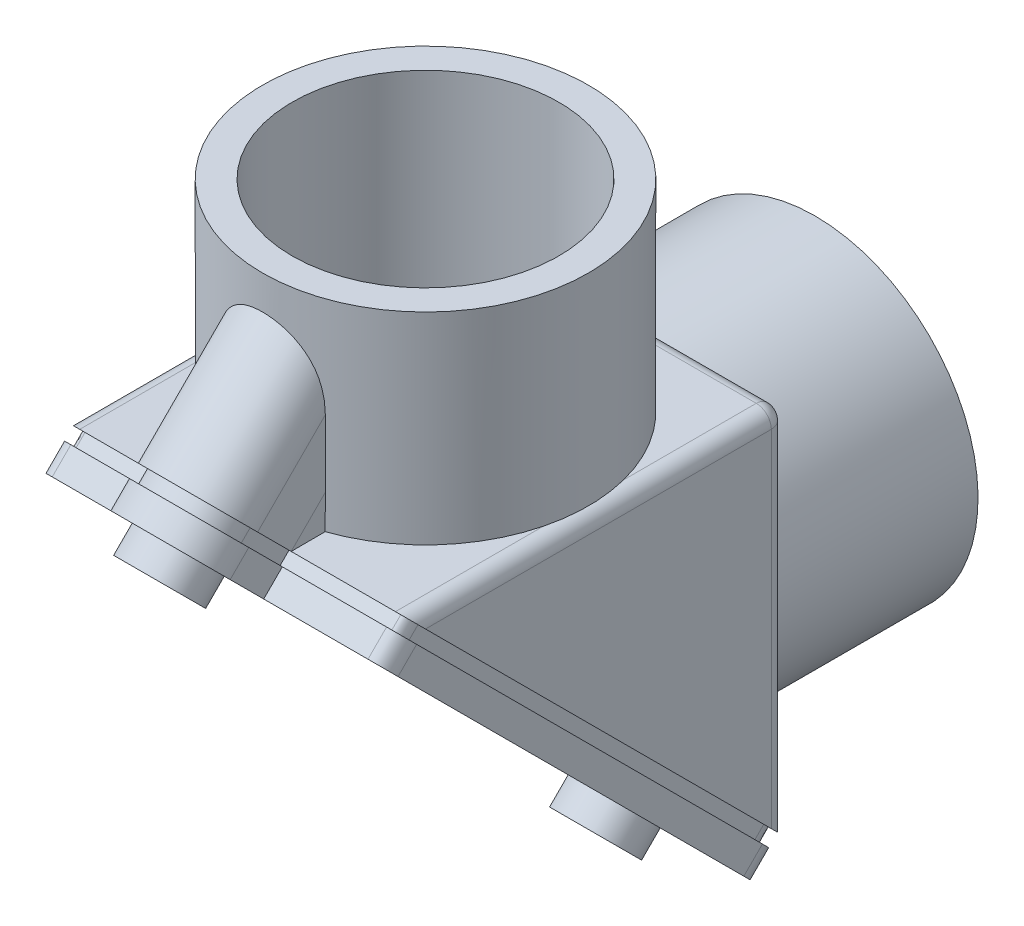
from build123d import *

# Parameters (mm, degrees)
EXTRUDE1_DEPTH                = 17.526
EXTRUDE1_DEPTH_BACK           = 17.526
FILLET1_R                     = 1.524
SHELL1_T                      = -3.81
COVERMTNGHUBS_EXTRUDE2_DEPTH  = 17.526
ODSOCKETBOSS_SKETCH2_R        = 16.51
EXTRUDE3_DEPTH                = 20.447
ODSOCKETBOSS_SKETCH4_R        = 16.51
EXTRUDE4_DEPTH                = 20.447
SKETCH6_R                     = 13.5128
SOCKET_CUT_EXTRUDE1_DEPTH     = 19.8374
SKETCH7_R                     = 13.5128
SOCKET_CUT_EXTRUDE2_DEPTH     = 19.8374
SKETCH8_R                     = 10.795
SOCKETTHRU_CUT_EXTRUDE3_DEPTH = 64.078716778
SKETCH9_R                     = 10.795
SOCKETTHRU_CUT_EXTRUDE4_DEPTH = 64.078716778
EXTRUDE5_DEPTH                = 1.27
EXTRUDE6_START                = 2.667
EXTRUDE6_DEPTH                = 2.667
SKETCH12_R                    = 3.81
EXTRUDE7_DEPTH                = 2.667


with BuildPart() as part:
    # Sketch1 → Extrude1 (new, two sides: drawn at the far end of the back side and taken through both)
    with BuildSketch(Plane(origin=(0, 0, 0), x_dir=(0, 0, -1), z_dir=(1, 0, 0)).offset(-EXTRUDE1_DEPTH_BACK)):
        Polygon((0, 19.05), (-19.05, 19.05), (19.05, -19.05), (19.05, 0), (19.05, 19.05), align=None)
    extrude(amount=EXTRUDE1_DEPTH + EXTRUDE1_DEPTH_BACK)

    # Fillet1
    fillet1_edges = [part.edges().sort_by_distance(p)[0] for p in [
        (-17.526, 0, -19.05),
        (-17.526, 19.05, 0),
        (0, 19.05, -19.05),
        (17.526, 0, -19.05),
        (17.526, 19.05, 0),
    ]]
    fillet(fillet1_edges, radius=FILLET1_R)

    # Shell1
    shell1_openings = [part.faces().sort_by_distance(p)[0] for p in [
        (0, 0, 0),
    ]]
    offset(amount=SHELL1_T, openings=shell1_openings, kind=Kind.INTERSECTION)

    # Sketch5 → CoverMtngHubs-Extrude2 (add)
    with BuildSketch(Plane(origin=(0, 0, 0), x_dir=(1, 0, 0), z_dir=(0, -0.7071067811865477, 0.7071067811865475))):
        with BuildLine():
            Line((-5.4356, 31.75), (-5.4356, 26.940768363))
            Line((-5.4356, 26.940768363), (-5.4356, 22.712927931))
            Line((-5.4356, 22.712927931), (5.41587582, 22.712927931))
            Line((5.41587582, 22.712927931), (5.4356, 26.940768363))
            Line((5.4356, 26.940768363), (5.4356, 31.75))
            ThreePointArc((5.4356, 31.75), (0, 37.1856), (-5.4356, 31.75))
        make_face()
        with BuildLine():
            Line((5.4356, -31.75), (5.4356, -26.940768363))
            Line((5.4356, -26.940768363), (5.41587582, -22.712927931))
            Line((5.41587582, -22.712927931), (-5.4356, -22.712927931))
            Line((-5.4356, -22.712927931), (-5.4356, -26.940768363))
            Line((-5.4356, -26.940768363), (-5.4356, -31.75))
            ThreePointArc((-5.4356, -31.75), (0, -37.1856), (5.4356, -31.75))
        make_face()
    extrude(amount=-COVERMTNGHUBS_EXTRUDE2_DEPTH)

    # ODsocketboss-Sketch2 → Extrude3 (add)
    with BuildSketch(Plane(origin=(0, 19.05, 0), x_dir=(-1, 0, 0), z_dir=(0, 1, 0))):
        Circle(ODSOCKETBOSS_SKETCH2_R)
    extrude(amount=EXTRUDE3_DEPTH)

    # ODsocketboss-Sketch4 → Extrude4 (add)
    with BuildSketch(Plane(origin=(0, 0, -19.05), x_dir=(-1, 0, 0), z_dir=(0, 0, -1))):
        Circle(ODSOCKETBOSS_SKETCH4_R)
    extrude(amount=EXTRUDE4_DEPTH)

    # Sketch6 → Socket--Cut-Extrude1 (cut)
    with BuildSketch(Plane(origin=(0, 0, -39.497), x_dir=(-1, 0, 0), z_dir=(0, 0, -1))):
        Circle(SKETCH6_R)
    extrude(amount=-SOCKET_CUT_EXTRUDE1_DEPTH, mode=Mode.SUBTRACT)

    # Sketch7 → Socket--Cut-Extrude2 (cut)
    with BuildSketch(Plane(origin=(0, 39.497, 0), x_dir=(-1, 0, 0), z_dir=(0, 1, 0))):
        Circle(SKETCH7_R)
    extrude(amount=-SOCKET_CUT_EXTRUDE2_DEPTH, mode=Mode.SUBTRACT)

    # Sketch8 → SocketTHRU-Cut-Extrude3 (cut, through all)
    with BuildSketch(Plane(origin=(0, 0, -19.6596), x_dir=(-1, 0, 0), z_dir=(0, 0, -1))):
        Circle(SKETCH8_R)
    extrude(amount=-SOCKETTHRU_CUT_EXTRUDE3_DEPTH, mode=Mode.SUBTRACT)

    # Sketch9 → SocketTHRU-Cut-Extrude4 (cut, through all)
    with BuildSketch(Plane(origin=(0, 19.6596, 0), x_dir=(-1, 0, 0), z_dir=(0, 1, 0))):
        Circle(SKETCH9_R)
    extrude(amount=-SOCKETTHRU_CUT_EXTRUDE4_DEPTH, mode=Mode.SUBTRACT)

    # Sketch10 → Extrude5 (add)
    with BuildSketch(Plane(origin=(0, 0, 0), x_dir=(1, 0, 0), z_dir=(0, -0.7071067811865477, 0.7071067811865475))):
        with BuildLine():
            Line((-4.6736, 31.75), (-4.6736, 26.178768363))
            Line((-4.6736, 26.178768363), (-16.002, 26.178768363))
            add(Edge.make_bspline(
                [(-16.002, 26.178768363), (-16.074874104, 26.178768363), (-16.144329506, 26.152769922), (-16.267023759, 26.078983528), (-16.321851808, 26.030722145), (-16.466647042, 25.873249143), (-16.540927648, 25.747914689), (-16.65540061, 25.488073251), (-16.696734257, 25.349541873), (-16.750804354, 25.07034225), (-16.764, 24.928834274), (-16.764, 24.785506894)],
                knots=[0, 0, 0, 0, 0.125, 0.125, 0.25, 0.25, 0.5, 0.5, 0.75, 0.75, 1, 1, 1, 1], degree=3))
            Line((-16.764, 24.785506894), (-16.764, -24.785506894))
            add(Edge.make_bspline(
                [(-16.764, -24.785506894), (-16.764, -24.928904831), (-16.750787013, -25.070024584), (-16.697192472, -25.347579683), (-16.656344373, -25.485586581), (-16.541283192, -25.747448207), (-16.467043517, -25.872703505), (-16.322186584, -26.030414967), (-16.26747506, -26.07865822), (-16.144508265, -26.152716047), (-16.074734527, -26.178768363), (-16.002, -26.178768363)],
                knots=[0, 0, 0, 0, 0.25, 0.25, 0.5, 0.5, 0.75, 0.75, 0.875, 0.875, 1, 1, 1, 1], degree=3))
            Line((-16.002, -26.178768363), (-4.6736, -26.178768363))
            Line((-4.6736, -26.178768363), (-4.6736, -31.75))
            ThreePointArc((-4.6736, -31.75), (0, -36.4236), (4.6736, -31.75))
            Line((4.6736, -31.75), (4.6736, -26.178768363))
            Line((4.6736, -26.178768363), (16.002, -26.178768363))
            add(Edge.make_bspline(
                [(16.002, -26.178768363), (16.074874104, -26.178768363), (16.144329506, -26.152769922), (16.267023759, -26.078983528), (16.321851808, -26.030722145), (16.466647042, -25.873249143), (16.540927648, -25.747914689), (16.65540061, -25.488073251), (16.696734257, -25.349541873), (16.750804354, -25.07034225), (16.764, -24.928834274), (16.764, -24.785506894)],
                knots=[0, 0, 0, 0, 0.125, 0.125, 0.25, 0.25, 0.5, 0.5, 0.75, 0.75, 1, 1, 1, 1], degree=3))
            Line((16.764, -24.785506894), (16.764, 24.785506894))
            add(Edge.make_bspline(
                [(16.764, 24.785506894), (16.764, 24.928904831), (16.750787013, 25.070024584), (16.697192472, 25.347579683), (16.656344373, 25.485586581), (16.541283192, 25.747448207), (16.467043517, 25.872703505), (16.322186584, 26.030414967), (16.26747506, 26.07865822), (16.144508265, 26.152716047), (16.074734527, 26.178768363), (16.002, 26.178768363)],
                knots=[0, 0, 0, 0, 0.25, 0.25, 0.5, 0.5, 0.75, 0.75, 0.875, 0.875, 1, 1, 1, 1], degree=3))
            Line((16.002, 26.178768363), (4.6736, 26.178768363))
            Line((4.6736, 26.178768363), (4.6736, 31.75))
            ThreePointArc((4.6736, 31.75), (0, 36.4236), (-4.6736, 31.75))
        make_face()
    extrude(amount=EXTRUDE5_DEPTH)

    # Sketch11 → Extrude6 (add)
    with BuildSketch(Plane(origin=(0, -0.898025612, 0.898025612), x_dir=(1, 0, 0), z_dir=(0, -0.7071067811865476, 0.7071067811865476)).offset(EXTRUDE6_START)):
        with BuildLine():
            Line((-5.4356, 31.75), (-5.4356, 26.940768363))
            Line((-5.4356, 26.940768363), (-16.002, 26.940768363))
            add(Edge.make_bspline(
                [(-16.002, 26.940768363), (-17.526, 26.940768363), (-17.526, 24.785506894)],
                knots=[3.141592654, 3.141592654, 3.141592654, 4.71238898, 4.71238898, 4.71238898], degree=2, weights=[1, 0.707106781, 1]))
            Line((-17.526, 24.785506894), (-17.526, -24.785506894))
            add(Edge.make_bspline(
                [(-17.526, -24.785506894), (-17.526, -26.940768363), (-16.002, -26.940768363)],
                knots=[4.71238898, 4.71238898, 4.71238898, 6.283185307, 6.283185307, 6.283185307], degree=2, weights=[1, 0.707106781, 1]))
            Line((-16.002, -26.940768363), (-5.4356, -26.940768363))
            Line((-5.4356, -26.940768363), (-5.4356, -31.75))
            ThreePointArc((-5.4356, -31.75), (0, -37.1856), (5.4356, -31.75))
            Line((5.4356, -31.75), (5.4356, -26.940768363))
            Line((5.4356, -26.940768363), (16.002, -26.940768363))
            add(Edge.make_bspline(
                [(16.002, -26.940768363), (17.526, -26.940768363), (17.526, -24.785506894)],
                knots=[3.141592654, 3.141592654, 3.141592654, 4.71238898, 4.71238898, 4.71238898], degree=2, weights=[1, 0.707106781, 1]))
            Line((17.526, -24.785506894), (17.526, 24.785506894))
            add(Edge.make_bspline(
                [(17.526, 24.785506894), (17.526, 26.940768363), (16.002, 26.940768363)],
                knots=[4.71238898, 4.71238898, 4.71238898, 6.283185307, 6.283185307, 6.283185307], degree=2, weights=[1, 0.707106781, 1]))
            Line((16.002, 26.940768363), (5.4356, 26.940768363))
            Line((5.4356, 26.940768363), (5.4356, 31.75))
            ThreePointArc((5.4356, 31.75), (0, 37.1856), (-5.4356, 31.75))
        make_face()
    extrude(amount=-EXTRUDE6_DEPTH)

    # Sketch12 → Extrude7 (add)
    with BuildSketch(Plane(origin=(0, -2.783879398, 2.783879398), x_dir=(1, 0, 0), z_dir=(0, -0.7071067811865477, 0.7071067811865475))):
        with Locations((0, -30.983715374)):
            Circle(SKETCH12_R)
        with Locations((0, 31.505588599)):
            Circle(SKETCH12_R)
    extrude(amount=EXTRUDE7_DEPTH)


solid = part.part
